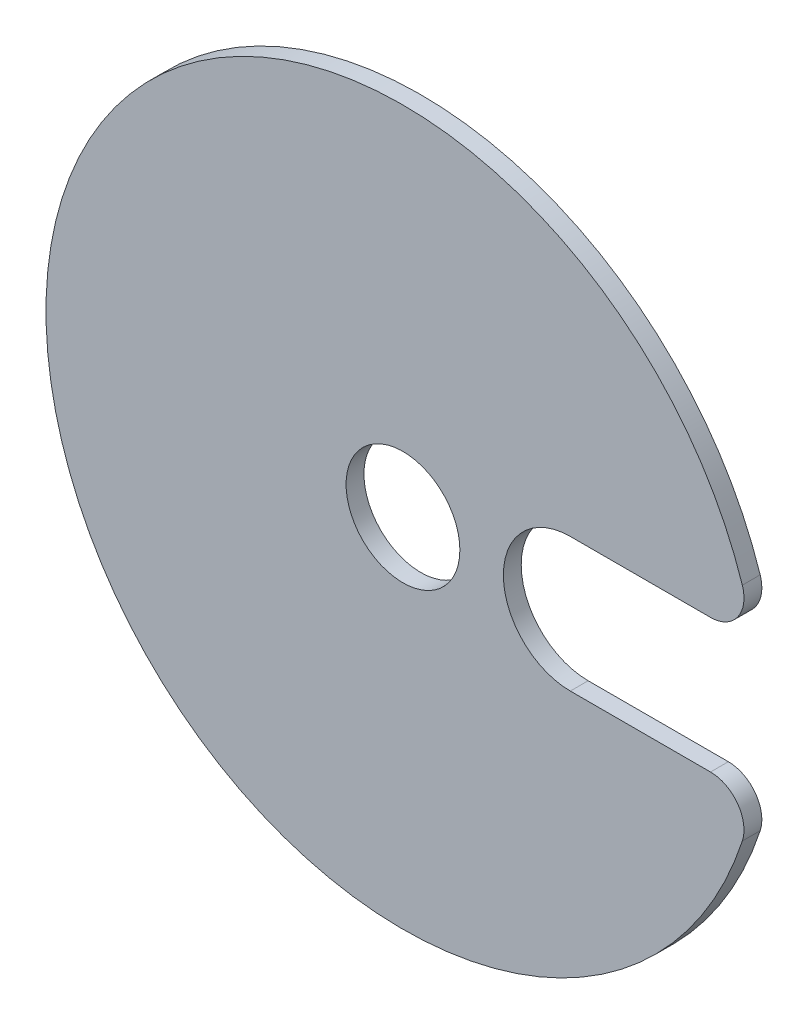
from build123d import *

# Parameters (mm, degrees)
ESQUISSE1_R        = 5.1
BOSS_EXTRU_1_DEPTH = 1.6
CONG_1_R           = 3


with BuildPart() as part:
    # Esquisse1 → Boss.-Extru.1 (new body)
    with BuildSketch(Plane.XY):
        with BuildLine():
            Line((31.432467291, 6), (15, 6))
            ThreePointArc((15, 6), (9, 0), (15, -6))
            Line((15, -6), (31.432467291, -6))
            ThreePointArc((31.432467291, -6), (-32, 0), (31.432467291, 6))
        make_face()
        Circle(ESQUISSE1_R, mode=Mode.SUBTRACT)
    extrude(amount=BOSS_EXTRU_1_DEPTH)

    # Congé1
    cong_1_edges = [part.edges().sort_by_distance(p)[0] for p in [
        (31.432467291, -6, 0.8),
        (31.432467291, 6, 0.8),
    ]]
    fillet(cong_1_edges, radius=CONG_1_R)


solid = part.part
